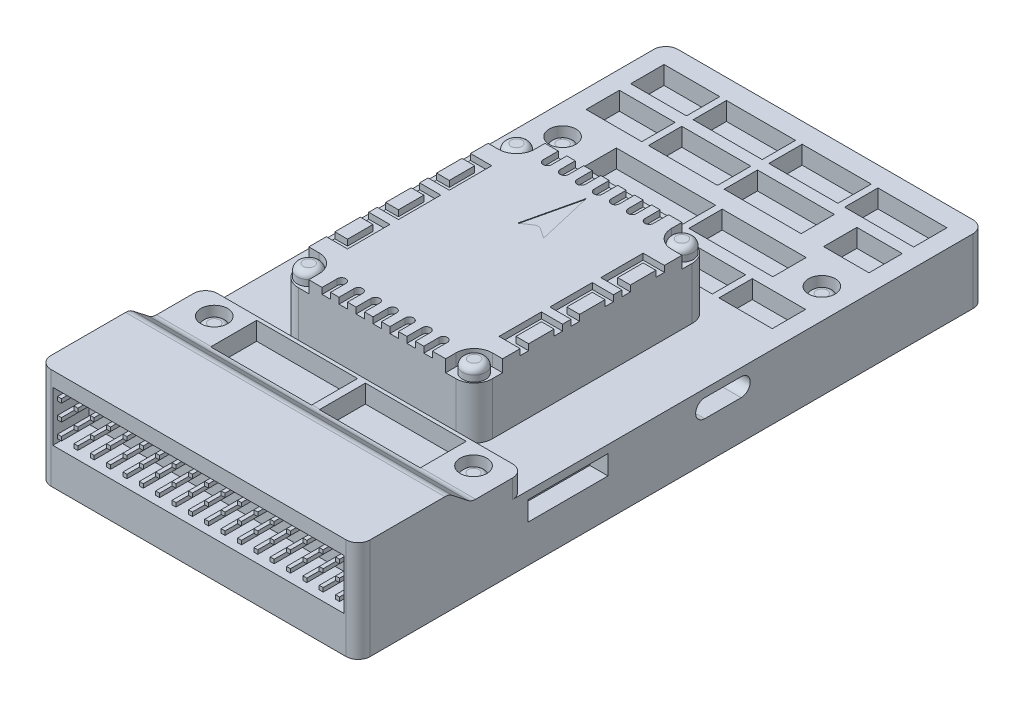
from build123d import *

# Parameters (mm, degrees)
BOSS_EXTRUDE1_DEPTH      = 26.35
SKETCH3_W                = 32
SKETCH3_H                = 39
BOSS_EXTRUDE2_DEPTH      = 10.6
SKETCH4_W                = 9.2
SKETCH4_H                = 5.5
SKETCH4_W_2              = 11.4
SKETCH4_W_3              = 12.7
SKETCH4_W_4              = 7.5
SKETCH4_W_5              = 16.38
SKETCH4_W_6              = 13.85
SKETCH4_W_7              = 8.8
SKETCH4_W_8              = 17
CUT_EXTRUDE1_DEPTH       = 3
SKETCH5_W                = 16.65
SKETCH5_H                = 7.6
CUT_EXTRUDE2_DEPTH       = 3
SKETCH6_W                = 48.1
SKETCH6_H                = 8.3
CUT_EXTRUDE3_DEPTH       = 6
SKETCH7_W                = 0.65
SKETCH7_H                = 0.65
BOSS_EXTRUDE3_DEPTH      = 6
SKETCH8_W                = 13.3
SKETCH8_H                = 3.3
CUT_EXTRUDE4_DEPTH       = 3
SKETCH9_W                = 13.25
SKETCH9_H                = 3.2
CUT_EXTRUDE5_DEPTH       = 3
SKETCH10_R               = 1.25
CUT_EXTRUDE6_DEPTH       = 3
SKETCH11_R               = 2.2
CUT_EXTRUDE7_DEPTH       = 3
FILLET1_R                = 2
FILLET2_R                = 3
CUT_EXTRUDE8_DEPTH       = 1
SKETCH13_W               = 6.3
SKETCH13_H               = 7
SKETCH13_W_2             = 3.5
SKETCH13_H_2             = 4.2
CUT_EXTRUDE9_DEPTH       = 1
CUT_EXTRUDE10_DEPTH      = 62.855274634
CUT_EXTRUDE10_DEPTH_BACK = 2
SKETCH15_R               = 1.9
BOSS_EXTRUDE4_DEPTH      = 2
FILLET3_R                = 1
SKETCH17_R               = 2.2
CUT_EXTRUDE11_DEPTH      = 3
SKETCH18_R               = 2.2
CUT_EXTRUDE12_DEPTH      = 3
SKETCH19_R               = 1.9
BOSS_EXTRUDE5_DEPTH      = 2
SKETCH20_R               = 1.9
BOSS_EXTRUDE6_DEPTH      = 2
FILLET4_R                = 1
CUT_EXTRUDE13_DEPTH      = 0.1


with BuildPart() as part:
    # Sketch2 → Boss-Extrude1 (new, symmetric)
    with BuildSketch(Plane(origin=(0, 0, 0), x_dir=(0, 0, -1), z_dir=(1, 0, 0))):
        Polygon((-51.75, 0), (51.75, 0), (51.75, 10.7), (-24.25, 10.7), (-24.25, 13.8), (-33.05, 13.8), (-36.75, 16.7), (-51.75, 16.7), align=None)
    extrude(amount=BOSS_EXTRUDE1_DEPTH, both=True)

    # Sketch3 → Boss-Extrude2 (add)
    with BuildSketch(Plane(origin=(0, 10.7, 0), x_dir=(1, 0, 0), z_dir=(0, 1, 0))):
        with Locations((0, -2.75)):
            Rectangle(SKETCH3_W, SKETCH3_H)
    extrude(amount=BOSS_EXTRUDE2_DEPTH)

    # Sketch4 → Cut-Extrude1 (cut)
    with BuildSketch(Plane(origin=(0, 10.7, 0), x_dir=(1, 0, 0), z_dir=(0, 1, 0))):
        with Locations((-18.75, 45.7)):
            Rectangle(SKETCH4_W, SKETCH4_H)
        with Locations((-7.35, 45.7)):
            Rectangle(SKETCH4_W_2, SKETCH4_H)
        with Locations((5.15, 45.7)):
            Rectangle(SKETCH4_W_2, SKETCH4_H)
        with Locations((17.65, 45.7)):
            Rectangle(SKETCH4_W_2, SKETCH4_H)
        with Locations((-18.75, 38.325711436)):
            Rectangle(SKETCH4_W, SKETCH4_H)
        with Locations((-7.35, 38.325711436)):
            Rectangle(SKETCH4_W_2, SKETCH4_H)
        with Locations((5.8, 38.325711436)):
            Rectangle(SKETCH4_W_3, SKETCH4_H)
        with Locations((19.6, 38.325711436)):
            Rectangle(SKETCH4_W_4, SKETCH4_H)
        with Locations((-7.16, 29.825711436)):
            Rectangle(SKETCH4_W_5, SKETCH4_H)
        with Locations((9.055, 29.825711436)):
            Rectangle(SKETCH4_W_6, SKETCH4_H)
        with Locations((-18.95, 22.360180271)):
            Rectangle(SKETCH4_W_7, SKETCH4_H)
        with Locations((-9.05, 22.360180271)):
            Rectangle(SKETCH4_W_7, SKETCH4_H)
        with Locations((4.95, 22.360180271)):
            Rectangle(SKETCH4_W_8, SKETCH4_H)
        with Locations((18.95, 22.360180271)):
            Rectangle(SKETCH4_W_7, SKETCH4_H)
    extrude(amount=-CUT_EXTRUDE1_DEPTH, mode=Mode.SUBTRACT)

    # Sketch5 → Cut-Extrude2 (cut)
    with BuildSketch(Plane(origin=(0, 13.8, 0), x_dir=(1, 0, 0), z_dir=(0, 1, 0))):
        with Locations((-8.975, -28.65)):
            Rectangle(SKETCH5_W, SKETCH5_H)
        with Locations((8.975, -28.65)):
            Rectangle(SKETCH5_W, SKETCH5_H)
    extrude(amount=-CUT_EXTRUDE2_DEPTH, mode=Mode.SUBTRACT)

    # Sketch6 → Cut-Extrude3 (cut)
    with BuildSketch(Plane.XY.offset(51.75)):
        with Locations((0, 10.15)):
            Rectangle(SKETCH6_W, SKETCH6_H)
    extrude(amount=-CUT_EXTRUDE3_DEPTH, mode=Mode.SUBTRACT)

    # Sketch7 → Boss-Extrude3 (add)
    with BuildSketch(Plane.XY.offset(45.75)):
        with Locations((-22.943198273, 13.056709451)):
            Rectangle(SKETCH7_W, SKETCH7_H)
        with Locations((-20.243198273, 13.056709451)):
            Rectangle(SKETCH7_W, SKETCH7_H)
        with Locations((-17.543198273, 13.056709451)):
            Rectangle(SKETCH7_W, SKETCH7_H)
        with Locations((-14.843198273, 13.056709451)):
            Rectangle(SKETCH7_W, SKETCH7_H)
        with Locations((-12.143198273, 13.056709451)):
            Rectangle(SKETCH7_W, SKETCH7_H)
        with Locations((-9.443198273, 13.056709451)):
            Rectangle(SKETCH7_W, SKETCH7_H)
        with Locations((-6.743198273, 13.056709451)):
            Rectangle(SKETCH7_W, SKETCH7_H)
        with Locations((-4.043198273, 13.056709451)):
            Rectangle(SKETCH7_W, SKETCH7_H)
        with Locations((-1.343198273, 13.056709451)):
            Rectangle(SKETCH7_W, SKETCH7_H)
        with Locations((1.356801727, 13.056709451)):
            Rectangle(SKETCH7_W, SKETCH7_H)
        with Locations((4.056801727, 13.056709451)):
            Rectangle(SKETCH7_W, SKETCH7_H)
        with Locations((6.756801727, 13.056709451)):
            Rectangle(SKETCH7_W, SKETCH7_H)
        with Locations((9.456801727, 13.056709451)):
            Rectangle(SKETCH7_W, SKETCH7_H)
        with Locations((12.156801727, 13.056709451)):
            Rectangle(SKETCH7_W, SKETCH7_H)
        with Locations((14.856801727, 13.056709451)):
            Rectangle(SKETCH7_W, SKETCH7_H)
        with Locations((17.556801727, 13.056709451)):
            Rectangle(SKETCH7_W, SKETCH7_H)
        with Locations((20.256801727, 13.056709451)):
            Rectangle(SKETCH7_W, SKETCH7_H)
        with Locations((22.956801727, 13.056709451)):
            Rectangle(SKETCH7_W, SKETCH7_H)
        with Locations((-20.243198273, 10.356709451)):
            Rectangle(SKETCH7_W, SKETCH7_H)
        with Locations((-17.543198273, 10.356709451)):
            Rectangle(SKETCH7_W, SKETCH7_H)
        with Locations((-14.843198273, 10.356709451)):
            Rectangle(SKETCH7_W, SKETCH7_H)
        with Locations((-12.143198273, 10.356709451)):
            Rectangle(SKETCH7_W, SKETCH7_H)
        with Locations((-9.443198273, 10.356709451)):
            Rectangle(SKETCH7_W, SKETCH7_H)
        with Locations((-6.743198273, 10.356709451)):
            Rectangle(SKETCH7_W, SKETCH7_H)
        with Locations((-4.043198273, 10.356709451)):
            Rectangle(SKETCH7_W, SKETCH7_H)
        with Locations((-1.343198273, 10.356709451)):
            Rectangle(SKETCH7_W, SKETCH7_H)
        with Locations((1.356801727, 10.356709451)):
            Rectangle(SKETCH7_W, SKETCH7_H)
        with Locations((4.056801727, 10.356709451)):
            Rectangle(SKETCH7_W, SKETCH7_H)
        with Locations((6.756801727, 10.356709451)):
            Rectangle(SKETCH7_W, SKETCH7_H)
        with Locations((9.456801727, 10.356709451)):
            Rectangle(SKETCH7_W, SKETCH7_H)
        with Locations((12.156801727, 10.356709451)):
            Rectangle(SKETCH7_W, SKETCH7_H)
        with Locations((14.856801727, 10.356709451)):
            Rectangle(SKETCH7_W, SKETCH7_H)
        with Locations((17.556801727, 10.356709451)):
            Rectangle(SKETCH7_W, SKETCH7_H)
        with Locations((20.256801727, 10.356709451)):
            Rectangle(SKETCH7_W, SKETCH7_H)
        with Locations((22.956801727, 10.356709451)):
            Rectangle(SKETCH7_W, SKETCH7_H)
        with Locations((-20.243198273, 7.656709451)):
            Rectangle(SKETCH7_W, SKETCH7_H)
        with Locations((-17.543198273, 7.656709451)):
            Rectangle(SKETCH7_W, SKETCH7_H)
        with Locations((-14.843198273, 7.656709451)):
            Rectangle(SKETCH7_W, SKETCH7_H)
        with Locations((-12.143198273, 7.656709451)):
            Rectangle(SKETCH7_W, SKETCH7_H)
        with Locations((-9.443198273, 7.656709451)):
            Rectangle(SKETCH7_W, SKETCH7_H)
        with Locations((-6.743198273, 7.656709451)):
            Rectangle(SKETCH7_W, SKETCH7_H)
        with Locations((-4.043198273, 7.656709451)):
            Rectangle(SKETCH7_W, SKETCH7_H)
        with Locations((-1.343198273, 7.656709451)):
            Rectangle(SKETCH7_W, SKETCH7_H)
        with Locations((1.356801727, 7.656709451)):
            Rectangle(SKETCH7_W, SKETCH7_H)
        with Locations((4.056801727, 7.656709451)):
            Rectangle(SKETCH7_W, SKETCH7_H)
        with Locations((6.756801727, 7.656709451)):
            Rectangle(SKETCH7_W, SKETCH7_H)
        with Locations((9.456801727, 7.656709451)):
            Rectangle(SKETCH7_W, SKETCH7_H)
        with Locations((12.156801727, 7.656709451)):
            Rectangle(SKETCH7_W, SKETCH7_H)
        with Locations((14.856801727, 7.656709451)):
            Rectangle(SKETCH7_W, SKETCH7_H)
        with Locations((17.556801727, 7.656709451)):
            Rectangle(SKETCH7_W, SKETCH7_H)
        with Locations((20.256801727, 7.656709451)):
            Rectangle(SKETCH7_W, SKETCH7_H)
        with Locations((22.956801727, 7.656709451)):
            Rectangle(SKETCH7_W, SKETCH7_H)
        with Locations((-22.943198273, 10.356709451)):
            Rectangle(SKETCH7_W, SKETCH7_H)
        with Locations((-22.943198273, 7.656709451)):
            Rectangle(SKETCH7_W, SKETCH7_H)
    extrude(amount=BOSS_EXTRUDE3_DEPTH)

    # Sketch8 → Cut-Extrude4 (cut)
    with BuildSketch(Plane.ZY.offset(26.35)):
        with Locations((17.1, 7.75)):
            Rectangle(SKETCH8_W, SKETCH8_H)
    extrude(amount=-CUT_EXTRUDE4_DEPTH, mode=Mode.SUBTRACT)

    # Sketch9 → Cut-Extrude5 (cut)
    with BuildSketch(Plane(origin=(26.35, 0, 0), x_dir=(0, 0, -1), z_dir=(1, 0, 0))):
        with Locations((-17.125, 7.8)):
            Rectangle(SKETCH9_W, SKETCH9_H)
        with BuildLine():
            Line((5.47, 9.4), (11.47, 9.4))
            ThreePointArc((11.47, 9.4), (12.97, 7.9), (11.47, 6.4))
            Line((11.47, 6.4), (5.47, 6.4))
            ThreePointArc((5.47, 6.4), (3.97, 7.9), (5.47, 9.4))
        make_face()
    extrude(amount=-CUT_EXTRUDE5_DEPTH, mode=Mode.SUBTRACT)

    # Sketch10 → Cut-Extrude6 (cut)
    with BuildSketch(Plane.XZ):
        with Locations(Location((-21.4, 27.75, 0), (0, 0, 270))):
            Circle(SKETCH10_R)
        with Locations(Location((21.4, 27.75, 0), (0, 0, 270))):
            Circle(SKETCH10_R)
        with Locations(Location((21.4, -29.75, 0), (0, 0, 270))):
            Circle(SKETCH10_R)
        with Locations(Location((-21.4, -29.75, 0), (0, 0, 270))):
            Circle(SKETCH10_R)
    extrude(amount=-CUT_EXTRUDE6_DEPTH, mode=Mode.SUBTRACT)

    # Sketch11 → Cut-Extrude7 (cut)
    with BuildSketch(Plane.XZ):
        with Locations(Location((-12.25, 17.75, 0), (0, 0, 270))):
            Circle(SKETCH11_R)
        with Locations(Location((12.25, 17.75, 0), (0, 0, 270))):
            Circle(SKETCH11_R)
        with Locations(Location((12.25, -13.75, 0), (0, 0, 270))):
            Circle(SKETCH11_R)
        with Locations(Location((-12.25, -13.75, 0), (0, 0, 270))):
            Circle(SKETCH11_R)
    extrude(amount=-CUT_EXTRUDE7_DEPTH, mode=Mode.SUBTRACT)

    # Fillet1
    # the kernel refuses this fillet: 2 mm, written as the material it adds along each edge
    with BuildSketch(Plane(origin=(-26.35, 13.8, 33.05), x_dir=(0, 0.6168816632266997, 0.7870559151513065), z_dir=(1, 0, 0))) as fillet1_piece_1_section:
        with BuildLine():
            CenterArc((FILLET1_R * 0.345194382558, -FILLET1_R), FILLET1_R, 90, 38.088772881)
            Line((-FILLET1_R * 0.271687280669, -FILLET1_R * 0.212944084849), (0, 0))
            Line((0, 0), (FILLET1_R * 0.345194382558, 0))
        make_face()
    fillet1_piece_1 = extrude(amount=52.7, mode=Mode.PRIVATE)
    fillet1_piece_1 = split(fillet1_piece_1, bisect_by=Plane(origin=(-21.825, 13.886922742, 32.45), z_dir=(0, 0, 1)), keep=Keep.TOP, mode=Mode.PRIVATE)
    add(fillet1_piece_1)
    with BuildSketch(Plane(origin=(-26.35, 13.8, 33.05), x_dir=(0, 0.6168816632266997, 0.7870559151513065), z_dir=(1, 0, 0))) as fillet1_piece_2_section:
        with BuildLine():
            CenterArc((FILLET1_R * 0.345194382558, -FILLET1_R), FILLET1_R, 90, 38.088772881)
            Line((-FILLET1_R * 0.271687280669, -FILLET1_R * 0.212944084849), (0, 0))
            Line((0, 0), (FILLET1_R * 0.345194382558, 0))
        make_face()
    fillet1_piece_2 = extrude(amount=54.425971913, mode=Mode.PRIVATE)
    fillet1_piece_2 = split(fillet1_piece_2, bisect_by=Plane(origin=(-17.3, 13.800613019, 32.427405118), z_dir=(-1, 0, 0)), keep=Keep.TOP, mode=Mode.PRIVATE)
    add(fillet1_piece_2)
    with BuildSketch(Plane(origin=(-28.075971913, 13.8, 33.05), x_dir=(0, 0.6168816632266997, 0.7870559151513065), z_dir=(1, 0, 0))) as fillet1_piece_3_section:
        with BuildLine():
            CenterArc((FILLET1_R * 0.345194382558, -FILLET1_R), FILLET1_R, 90, 38.088772881)
            Line((-FILLET1_R * 0.271687280669, -FILLET1_R * 0.212944084849), (0, 0))
            Line((0, 0), (FILLET1_R * 0.345194382558, 0))
        make_face()
    fillet1_piece_3 = extrude(amount=56.151943826, mode=Mode.PRIVATE)
    fillet1_piece_3 = split(fillet1_piece_3, bisect_by=Plane(origin=(-0.65, 13.800613019, 32.427405118), z_dir=(1, 0, 0)), keep=Keep.TOP, mode=Mode.PRIVATE)
    fillet1_piece_3 = split(fillet1_piece_3, bisect_by=Plane(origin=(0.65, 13.800613019, 32.427405118), z_dir=(-1, 0, 0)), keep=Keep.TOP, mode=Mode.PRIVATE)
    add(fillet1_piece_3)
    with BuildSketch(Plane(origin=(-28.075971913, 13.8, 33.05), x_dir=(0, 0.6168816632266997, 0.7870559151513065), z_dir=(1, 0, 0))) as fillet1_piece_4_section:
        with BuildLine():
            CenterArc((FILLET1_R * 0.345194382558, -FILLET1_R), FILLET1_R, 90, 38.088772881)
            Line((-FILLET1_R * 0.271687280669, -FILLET1_R * 0.212944084849), (0, 0))
            Line((0, 0), (FILLET1_R * 0.345194382558, 0))
        make_face()
    fillet1_piece_4 = extrude(amount=54.425971913, mode=Mode.PRIVATE)
    fillet1_piece_4 = split(fillet1_piece_4, bisect_by=Plane(origin=(17.3, 13.800613019, 32.427405118), z_dir=(1, 0, 0)), keep=Keep.TOP, mode=Mode.PRIVATE)
    add(fillet1_piece_4)
    # the kernel refuses this fillet: 2 mm, written as the material it takes off along each edge
    with BuildSketch(Plane(origin=(28.075971913, 16.7, 36.75), x_dir=(0, 0, 1), z_dir=(-1, 0, 0))) as fillet1_2_piece_1:
        with BuildLine():
            CenterArc((FILLET1_R * 0.345194382558, -FILLET1_R), FILLET1_R, 90, 38.088772881)
            Line((-FILLET1_R * 0.271687280669, -FILLET1_R * 0.212944084849), (0, 0))
            Line((0, 0), (FILLET1_R * 0.345194382558, 0))
        make_face()
    extrude(amount=56.151943826, mode=Mode.SUBTRACT)
    with BuildSketch(Plane(origin=(26.35, -5, -51.75), x_dir=(0, 0, 1), z_dir=(0, 1, 0)), Plane(origin=(-26.35, -5, -51.75), x_dir=(1, 0, 0), z_dir=(0, 1, 0))) as fillet1_2_piece_2:
        with BuildLine():
            CenterArc((FILLET1_R, -FILLET1_R), FILLET1_R, 90, 90)
            Line((0, -FILLET1_R), (0, 0))
            Line((0, 0), (FILLET1_R, 0))
        make_face()
    extrude(amount=20.7, mode=Mode.SUBTRACT)
    with BuildSketch(Plane(origin=(26.35, 21.7, 51.75), x_dir=(0, 0, -1), z_dir=(0, -1, 0)), Plane(origin=(-26.35, 21.7, 51.75), x_dir=(1, 0, 0), z_dir=(0, -1, 0))) as fillet1_2_piece_3:
        with BuildLine():
            CenterArc((FILLET1_R, -FILLET1_R), FILLET1_R, 90, 90)
            Line((0, -FILLET1_R), (0, 0))
            Line((0, 0), (FILLET1_R, 0))
        make_face()
    extrude(amount=26.7, mode=Mode.SUBTRACT)
    with BuildSketch(Plane(origin=(26.35, 10.7, 24.25), x_dir=(0, 0, 1), z_dir=(0, 1, 0)), Plane(origin=(-26.35, 10.7, 24.25), x_dir=(1, 0, 0), z_dir=(0, 1, 0))) as fillet1_2_piece_4:
        with BuildLine():
            CenterArc((FILLET1_R, -FILLET1_R), FILLET1_R, 90, 90)
            Line((0, -FILLET1_R), (0, 0))
            Line((0, 0), (FILLET1_R, 0))
        make_face()
    extrude(amount=8.1, mode=Mode.SUBTRACT)

    # Fillet2
    fillet2_edges = [part.edges().sort_by_distance(p)[0] for p in [
        (-16, 16, -16.75),
        (-16, 16, 22.25),
        (16, 16, 22.25),
        (16, 16, -16.75),
    ]]
    fillet(fillet2_edges, radius=FILLET2_R)

    # Sketch12 → Cut-Extrude8 (cut)
    with BuildSketch(Plane(origin=(0, 21.3, 0), x_dir=(1, 0, 0), z_dir=(0, 1, 0))):
        with BuildLine():
            Line((-7.7, 16.75), (-7.7, 14.25))
            ThreePointArc((-7.7, 14.25), (-8.4, 13.55), (-9.1, 14.25))
            Line((-9.1, 14.25), (-9.1, 16.75))
            ThreePointArc((-9.1, 16.75), (-8.4, 17.45), (-7.7, 16.75))
        make_face()
        with BuildLine():
            Line((-4.9, 16.75), (-4.9, 14.25))
            ThreePointArc((-4.9, 14.25), (-5.6, 13.55), (-6.3, 14.25))
            Line((-6.3, 14.25), (-6.3, 16.75))
            ThreePointArc((-6.3, 16.75), (-5.6, 17.45), (-4.9, 16.75))
        make_face()
        with BuildLine():
            Line((-2.1, 16.75), (-2.1, 14.25))
            ThreePointArc((-2.1, 14.25), (-2.8, 13.55), (-3.5, 14.25))
            Line((-3.5, 14.25), (-3.5, 16.75))
            ThreePointArc((-3.5, 16.75), (-2.8, 17.45), (-2.1, 16.75))
        make_face()
        with BuildLine():
            Line((0.7, 16.75), (0.7, 14.25))
            ThreePointArc((0.7, 14.25), (0, 13.55), (-0.7, 14.25))
            Line((-0.7, 14.25), (-0.7, 16.75))
            ThreePointArc((-0.7, 16.75), (0, 17.45), (0.7, 16.75))
        make_face()
        with BuildLine():
            Line((3.5, 16.75), (3.5, 14.25))
            ThreePointArc((3.5, 14.25), (2.8, 13.55), (2.1, 14.25))
            Line((2.1, 14.25), (2.1, 16.75))
            ThreePointArc((2.1, 16.75), (2.8, 17.45), (3.5, 16.75))
        make_face()
        with BuildLine():
            Line((6.3, 16.75), (6.3, 14.25))
            ThreePointArc((6.3, 14.25), (5.6, 13.55), (4.9, 14.25))
            Line((4.9, 14.25), (4.9, 16.75))
            ThreePointArc((4.9, 16.75), (5.6, 17.45), (6.3, 16.75))
        make_face()
        with BuildLine():
            Line((9.1, 16.75), (9.1, 14.25))
            ThreePointArc((9.1, 14.25), (8.4, 13.55), (7.7, 14.25))
            Line((7.7, 14.25), (7.7, 16.75))
            ThreePointArc((7.7, 16.75), (8.4, 17.45), (9.1, 16.75))
        make_face()
        with BuildLine():
            Line((-7.7, -22.25), (-7.7, -19.75))
            ThreePointArc((-7.7, -19.75), (-8.4, -19.05), (-9.1, -19.75))
            Line((-9.1, -19.75), (-9.1, -22.25))
            ThreePointArc((-9.1, -22.25), (-8.4, -22.95), (-7.7, -22.25))
        make_face()
        with BuildLine():
            Line((-4.9, -22.25), (-4.9, -19.75))
            ThreePointArc((-4.9, -19.75), (-5.6, -19.05), (-6.3, -19.75))
            Line((-6.3, -19.75), (-6.3, -22.25))
            ThreePointArc((-6.3, -22.25), (-5.6, -22.95), (-4.9, -22.25))
        make_face()
        with BuildLine():
            Line((-2.1, -22.25), (-2.1, -19.75))
            ThreePointArc((-2.1, -19.75), (-2.8, -19.05), (-3.5, -19.75))
            Line((-3.5, -19.75), (-3.5, -22.25))
            ThreePointArc((-3.5, -22.25), (-2.8, -22.95), (-2.1, -22.25))
        make_face()
        with BuildLine():
            Line((0.7, -22.25), (0.7, -19.75))
            ThreePointArc((0.7, -19.75), (0, -19.05), (-0.7, -19.75))
            Line((-0.7, -19.75), (-0.7, -22.25))
            ThreePointArc((-0.7, -22.25), (0, -22.95), (0.7, -22.25))
        make_face()
        with BuildLine():
            Line((3.5, -22.25), (3.5, -19.75))
            ThreePointArc((3.5, -19.75), (2.8, -19.05), (2.1, -19.75))
            Line((2.1, -19.75), (2.1, -22.25))
            ThreePointArc((2.1, -22.25), (2.8, -22.95), (3.5, -22.25))
        make_face()
        with BuildLine():
            Line((6.3, -22.25), (6.3, -19.75))
            ThreePointArc((6.3, -19.75), (5.6, -19.05), (4.9, -19.75))
            Line((4.9, -19.75), (4.9, -22.25))
            ThreePointArc((4.9, -22.25), (5.6, -22.95), (6.3, -22.25))
        make_face()
        with BuildLine():
            Line((9.1, -22.25), (9.1, -19.75))
            ThreePointArc((9.1, -19.75), (8.4, -19.05), (7.7, -19.75))
            Line((7.7, -19.75), (7.7, -22.25))
            ThreePointArc((7.7, -22.25), (8.4, -22.95), (9.1, -22.25))
        make_face()
    extrude(amount=-CUT_EXTRUDE8_DEPTH, mode=Mode.SUBTRACT)

    # Sketch13 → Cut-Extrude9 (cut)
    # profile 1 of 6: a face of its own
    with BuildSketch(Plane(origin=(0, 21.3, 0), x_dir=(1, 0, 0), z_dir=(0, 1, 0))):
        with Locations((-15.65, 5.65)):
            Rectangle(SKETCH13_W, SKETCH13_H)
        with Locations((-15.65, 5.65)):
            Rectangle(SKETCH13_W_2, SKETCH13_H_2, mode=Mode.SUBTRACT)
    # profile 2 of 6: a face of its own
    with BuildSketch(Plane(origin=(0, 21.3, 0), x_dir=(1, 0, 0), z_dir=(0, 1, 0))):
        with Locations((-15.65, -2.75)):
            Rectangle(SKETCH13_W, SKETCH13_H)
        with Locations((-15.65, -2.75)):
            Rectangle(SKETCH13_W_2, SKETCH13_H_2, mode=Mode.SUBTRACT)
    # profile 3 of 6: a face of its own
    with BuildSketch(Plane(origin=(0, 21.3, 0), x_dir=(1, 0, 0), z_dir=(0, 1, 0))):
        with Locations((-15.65, -11.15)):
            Rectangle(SKETCH13_W, SKETCH13_H)
        with Locations((-15.65, -11.15)):
            Rectangle(SKETCH13_W_2, SKETCH13_H_2, mode=Mode.SUBTRACT)
    # profile 4 of 6: a face of its own
    with BuildSketch(Plane(origin=(0, 21.3, 0), x_dir=(1, 0, 0), z_dir=(0, 1, 0))):
        with Locations((15.65, -11.15)):
            Rectangle(SKETCH13_W, SKETCH13_H)
        with Locations((15.65, -11.15)):
            Rectangle(SKETCH13_W_2, SKETCH13_H_2, mode=Mode.SUBTRACT)
    # profile 5 of 6: a face of its own
    with BuildSketch(Plane(origin=(0, 21.3, 0), x_dir=(1, 0, 0), z_dir=(0, 1, 0))):
        with Locations((15.65, -2.75)):
            Rectangle(SKETCH13_W, SKETCH13_H)
        with Locations((15.65, -2.75)):
            Rectangle(SKETCH13_W_2, SKETCH13_H_2, mode=Mode.SUBTRACT)
    # profile 6 of 6: a face of its own
    with BuildSketch(Plane(origin=(0, 21.3, 0), x_dir=(1, 0, 0), z_dir=(0, 1, 0))):
        with Locations((15.65, 5.65)):
            Rectangle(SKETCH13_W, SKETCH13_H)
        with Locations((15.65, 5.65)):
            Rectangle(SKETCH13_W_2, SKETCH13_H_2, mode=Mode.SUBTRACT)
    extrude(amount=-CUT_EXTRUDE9_DEPTH, mode=Mode.SUBTRACT)

    # Sketch14 → Cut-Extrude10 (cut, two sides: drawn at the far end of the back side and taken through both)
    with BuildSketch(Plane(origin=(0, 21.3, 0), x_dir=(1, 0, 0), z_dir=(0, 1, 0)).offset(-CUT_EXTRUDE10_DEPTH_BACK)):
        with BuildLine():
            Line((-16, 12.05), (-14.3, 12.05))
            ThreePointArc((-14.3, 12.05), (-12.178679656, 12.928679656), (-11.3, 15.05))
            Line((-11.3, 15.05), (-11.3, 16.75))
            Line((-11.3, 16.75), (-13, 16.75))
            ThreePointArc((-13, 16.75), (-15.121320344, 15.871320344), (-16, 13.75))
            Line((-16, 13.75), (-16, 12.05))
        make_face()
        with BuildLine():
            Line((11.3, 15.05), (11.3, 16.75))
            Line((11.3, 16.75), (13, 16.75))
            ThreePointArc((13, 16.75), (15.121320344, 15.871320344), (16, 13.75))
            Line((16, 13.75), (16, 12.05))
            Line((16, 12.05), (14.3, 12.05))
            ThreePointArc((14.3, 12.05), (12.178679656, 12.928679656), (11.3, 15.05))
        make_face()
        with BuildLine():
            Line((16, -17.55), (14.3, -17.55))
            ThreePointArc((14.3, -17.55), (12.178679656, -18.428679656), (11.3, -20.55))
            Line((11.3, -20.55), (11.3, -22.25))
            Line((11.3, -22.25), (13, -22.25))
            ThreePointArc((13, -22.25), (15.121320344, -21.371320344), (16, -19.25))
            Line((16, -19.25), (16, -17.55))
        make_face()
        with BuildLine():
            Line((-11.3, -20.55), (-11.3, -22.25))
            Line((-11.3, -22.25), (-13, -22.25))
            ThreePointArc((-13, -22.25), (-15.121320344, -21.371320344), (-16, -19.25))
            Line((-16, -19.25), (-16, -17.55))
            Line((-16, -17.55), (-14.3, -17.55))
            ThreePointArc((-14.3, -17.55), (-12.178679656, -18.428679656), (-11.3, -20.55))
        make_face()
    extrude(amount=CUT_EXTRUDE10_DEPTH + CUT_EXTRUDE10_DEPTH_BACK, mode=Mode.SUBTRACT)

    # Sketch15 → Boss-Extrude4 (add)
    with BuildSketch(Plane(origin=(0, 19.3, 0), x_dir=(1, 0, 0), z_dir=(0, 1, 0))):
        with Locations(Location((-13.65, -19.9, 0), (0, 0, 270))):
            Circle(SKETCH15_R)
        with Locations(Location((13.65, -19.9, 0), (0, 0, 90))):
            Circle(SKETCH15_R)
        with Locations(Location((13.65, 14.4, 0), (0, 0, 270))):
            Circle(SKETCH15_R)
        with Locations(Location((-13.65, 14.4, 0), (0, 0, 90))):
            Circle(SKETCH15_R)
    extrude(amount=BOSS_EXTRUDE4_DEPTH)

    # Fillet3
    fillet3_edges = [part.edges().sort_by_distance(p)[0] for p in [
        (-13.65, 21.3, 18),
        (13.65, 21.3, 21.8),
        (13.65, 21.3, -16.3),
        (-13.65, 21.3, -12.5),
    ]]
    fillet(fillet3_edges, radius=FILLET3_R)

    # Sketch17 → Cut-Extrude11 (cut)
    with BuildSketch(Plane(origin=(0, 13.8, 0), x_dir=(1, 0, 0), z_dir=(0, 1, 0))):
        with Locations(Location((-21.4, -27.75, 0), (0, 0, 270))):
            Circle(SKETCH17_R)
        with Locations(Location((21.4, -27.75, 0), (0, 0, 270))):
            Circle(SKETCH17_R)
        with Locations((21.4, 29.75)):
            Circle(SKETCH17_R)
        with Locations((-21.4, 29.75)):
            Circle(SKETCH17_R)
    extrude(amount=-CUT_EXTRUDE11_DEPTH, mode=Mode.SUBTRACT)

    # Sketch18 → Cut-Extrude12 (cut)
    with BuildSketch(Plane(origin=(0, 10.7, 0), x_dir=(1, 0, 0), z_dir=(0, 1, 0))):
        with Locations(Location((-21.4, 29.75, 0), (0, 0, 270))):
            Circle(SKETCH18_R)
        with Locations(Location((21.4, 29.75, 0), (0, 0, 270))):
            Circle(SKETCH18_R)
    extrude(amount=-CUT_EXTRUDE12_DEPTH, mode=Mode.SUBTRACT)

    # Sketch19 → Boss-Extrude5 (add)
    with BuildSketch(Plane(origin=(0, 7.7, 0), x_dir=(1, 0, 0), z_dir=(0, 1, 0))):
        with Locations(Location((-21.4, 29.75, 0), (0, 0, 270))):
            Circle(SKETCH19_R)
        with Locations(Location((21.4, 29.75, 0), (0, 0, 270))):
            Circle(SKETCH19_R)
    extrude(amount=BOSS_EXTRUDE5_DEPTH)

    # Sketch20 → Boss-Extrude6 (add)
    with BuildSketch(Plane(origin=(0, 10.8, 0), x_dir=(1, 0, 0), z_dir=(0, 1, 0))):
        with Locations(Location((-21.4, -27.75, 0), (0, 0, 270))):
            Circle(SKETCH20_R)
        with Locations(Location((21.4, -27.75, 0), (0, 0, 270))):
            Circle(SKETCH20_R)
    extrude(amount=BOSS_EXTRUDE6_DEPTH)

    # Fillet4
    fillet4_edges = [part.edges().sort_by_distance(p)[0] for p in [
        (-21.4, 9.7, -31.65),
        (21.4, 9.7, -31.65),
        (-21.4, 12.8, 25.85),
        (21.4, 12.8, 25.85),
    ]]
    fillet(fillet4_edges, radius=FILLET4_R)

    # Sketch21 → Cut-Extrude13 (cut)
    with BuildSketch(Plane(origin=(0, 21.3, 0), x_dir=(1, 0, 0), z_dir=(0, 1, 0))):
        with BuildLine():
            Line((0, 12.276769849), (-2.15, 3.076769849))
            Line((-2.15, 3.076769849), (-0.561046089, 4.153712348))
            ThreePointArc((-0.561046089, 4.153712348), (0, 4.325927783), (0.561046089, 4.153712348))
            Line((0.561046089, 4.153712348), (2.15, 3.076769849))
            Line((2.15, 3.076769849), (0, 12.276769849))
        make_face()
    extrude(amount=-CUT_EXTRUDE13_DEPTH, mode=Mode.SUBTRACT)


solid = part.part
